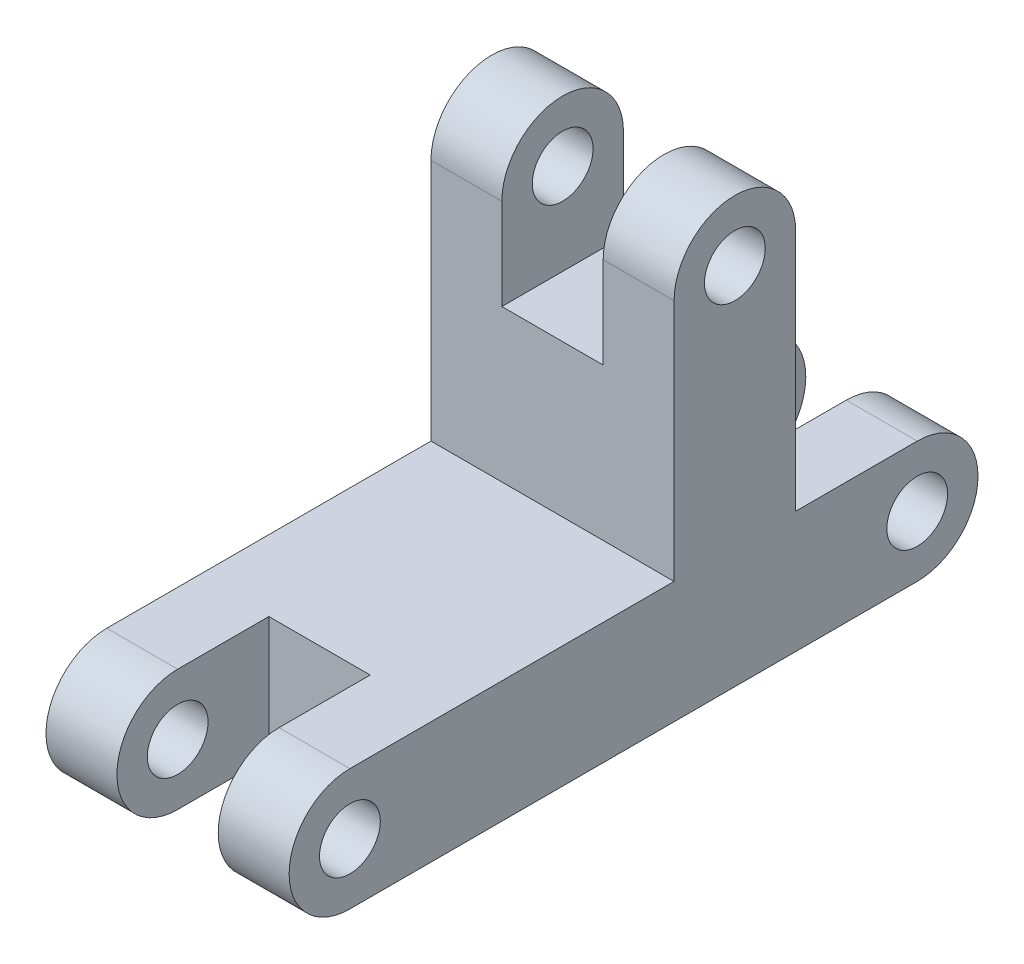
from build123d import *

# Parameters (mm, degrees)
CROQUIS1_R              = 1.5
SALIENTE_EXTRUIR1_DEPTH = 6
CROQUIS2_W              = 6
CROQUIS2_H              = 7.5
CROQUIS2_W_2            = 7.5
CROQUIS2_H_2            = 6
CORTAR_EXTRUIR1_DEPTH   = 2.5


with BuildPart() as part:
    # Croquis1 → Saliente-Extruir1 (new, symmetric)
    with BuildSketch(Plane(origin=(0, 0, 0), x_dir=(0, 0, -1), z_dir=(1, 0, 0))):
        with BuildLine():
            Line((-14, 3), (2, 3))
            Line((2, 3), (2, 15))
            ThreePointArc((2, 15), (5, 18), (8, 15))
            Line((8, 15), (8, 3))
            Line((8, 3), (14, 3))
            ThreePointArc((14, 3), (17, 0), (14, -3))
            Line((14, -3), (-14, -3))
            ThreePointArc((-14, -3), (-17, 0), (-14, 3))
        make_face()
        with Locations((14, 0)):
            Circle(CROQUIS1_R, mode=Mode.SUBTRACT)
        with Locations((5, 15)):
            Circle(CROQUIS1_R, mode=Mode.SUBTRACT)
        with Locations((-14, 0)):
            Circle(CROQUIS1_R, mode=Mode.SUBTRACT)
    extrude(amount=SALIENTE_EXTRUIR1_DEPTH, both=True)

    # Croquis2 → Cortar-Extruir1 (cut, symmetric)
    with BuildSketch(Plane(origin=(0, 0, 0), x_dir=(0, 0, -1), z_dir=(1, 0, 0))):
        with Locations((5, 14.25)):
            Rectangle(CROQUIS2_W, CROQUIS2_H)
        with Locations((-13.25, 0)):
            Rectangle(CROQUIS2_W_2, CROQUIS2_H_2)
        with Locations((13.25, 0)):
            Rectangle(CROQUIS2_W_2, CROQUIS2_H_2)
    extrude(amount=CORTAR_EXTRUIR1_DEPTH, both=True, mode=Mode.SUBTRACT)


solid = part.part
